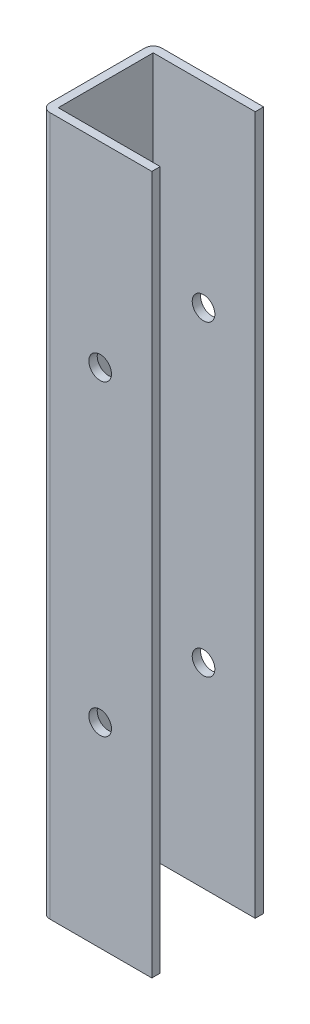
from build123d import *

# Parameters (mm, degrees)
SKETCH_1_W          = 74
SKETCH_1_H          = 34
EXTRUDE_1_DEPTH     = 250
SKETCH_2_W          = 41.646480438
SKETCH_2_H          = 42.526894273
CUT_EXTRUDE_1_DEPTH = 254.968501984
SKETCH_3_R          = 4.05
CUT_EXTRUDE_2_DEPTH = 257.32011236


with BuildPart() as part:
    # Эскиз1 → Вытянуть-Тонкостенный1 (new body)
    with BuildSketch(Plane(origin=(0, 0, 0), x_dir=(1, 0, 0), z_dir=(0, 1, 0))):
        with BuildLine():
            Line((40, 17), (40, -17))
            ThreePointArc((40, -17), (39.121320344, -19.121320344), (37, -20))
            Line((37, -20), (-37, -20))
            ThreePointArc((-37, -20), (-39.121320344, -19.121320344), (-40, -17))
            Line((-40, -17), (-40, 17))
            ThreePointArc((-40, 17), (-39.121320344, 19.121320344), (-37, 20))
            Line((-37, 20), (37, 20))
            ThreePointArc((37, 20), (39.121320344, 19.121320344), (40, 17))
        make_face()
        Rectangle(SKETCH_1_W, SKETCH_1_H, mode=Mode.SUBTRACT)
    extrude(amount=EXTRUDE_1_DEPTH)

    # Эскиз2 → Вырез-Вытянуть1 (cut, through all)
    with BuildSketch(Plane(origin=(0, 250, 0), x_dir=(1, 0, 0), z_dir=(0, 1, 0))):
        with Locations((20.323240219, -0.290673418)):
            Rectangle(SKETCH_2_W, SKETCH_2_H)
    extrude(amount=-CUT_EXTRUDE_1_DEPTH, mode=Mode.SUBTRACT)

    # Эскиз3 → Вырез-Вытянуть2 (cut, through all)
    with BuildSketch(Plane(origin=(0, 0, -20), x_dir=(-1, 0, 0), z_dir=(0, 0, -1))):
        with Locations((19, 180)):
            Circle(SKETCH_3_R)
        with Locations((19, 70)):
            Circle(SKETCH_3_R)
    extrude(amount=-CUT_EXTRUDE_2_DEPTH, mode=Mode.SUBTRACT)


solid = part.part
